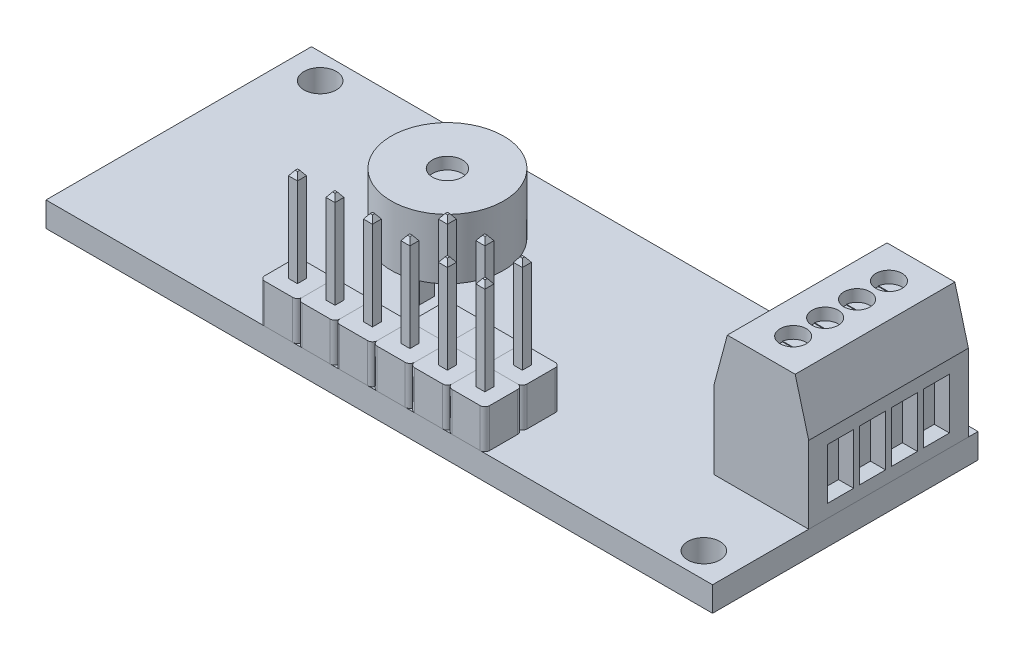
from build123d import *
from OCP.BRepFilletAPI import BRepFilletAPI_MakeChamfer

# Parameters (mm, degrees)
SKETCH1_W                 = 44.45
SKETCH1_H                 = 17.7038
BOSS_EXTRUDE1_DEPTH       = 0.8255
CUT_EXTRUDE1_DEPTH        = 24.979836522
CUT_EXTRUDE1_DEPTH_BACK   = 24.979836522
SKETCH2_R                 = 1.075
BOSS_EXTRUDE2_DEPTH       = 10.65
SKETCH4_W                 = 2.5
SKETCH4_H                 = 2.499995
BOSS_EXTRUDE3_DEPTH       = 2.599
SKETCH5_W                 = 0.6
SKETCH5_H                 = 0.6
BOSS_EXTRUDE4_DEPTH       = 6.25
CHAMFER1_SIZE             = 0.3175
CHAMFER1_SIZE2            = 0.222315893
FILLET1_R                 = 0.3175
LPATTERN2_COUNT           = 6
LPATTERN2_PITCH           = 2.5
LPATTERN3_COUNT           = 2
LPATTERN3_PITCH           = 2.5
SKETCH7_R                 = 3.75
BOSS_EXTRUDE5_DEPTH       = 6.45
SKETCH8_R                 = 3.75
SKETCH8_W                 = 1
SKETCH8_H                 = 1
CUT_EXTRUDE2_DEPTH        = 2.44
SKETCH9_R                 = 1
CUT_EXTRUDE3_DEPTH        = 0.79375
SKETCH10_R                = 0.875
CUT_EXTRUDE4_DEPTH        = 0.79375
SKETCH11_W                = 1.73
SKETCH11_H                = 3.4
CUT_EXTRUDE5_DEPTH        = 0.79375
CUT_EXTRUDE5_DRAFT        = -15
LPATTERN4_COPY_1_SKETCH_W = 1.73
LPATTERN4_COPY_1_SKETCH_H = 3.4
LPATTERN4_COPY_1_DEPTH    = 0.79375
LPATTERN4_COPY_1_DRAFT    = -15
LPATTERN4_COPY_2_SKETCH_W = 1.73
LPATTERN4_COPY_2_SKETCH_H = 3.4
LPATTERN4_COPY_2_DEPTH    = 0.79375
LPATTERN4_COPY_2_DRAFT    = -15
LPATTERN4_COPY_3_SKETCH_W = 1.73
LPATTERN4_COPY_3_SKETCH_H = 3.4
LPATTERN4_COPY_3_DEPTH    = 0.79375
LPATTERN4_COPY_3_DRAFT    = -15
CUT_EXTRUDE6_DEPTH        = 0.049609375
LPATTERN5_COUNT           = 4
LPATTERN5_PITCH           = 2.13


with BuildPart() as part:
    # Sketch1 → Boss-Extrude1 (new, symmetric)
    with BuildSketch(Plane(origin=(0, 0, 0), x_dir=(1, 0, 0), z_dir=(0, 1, 0))):
        Rectangle(SKETCH1_W, SKETCH1_H)
    extrude(amount=BOSS_EXTRUDE1_DEPTH, both=True)

    # Sketch2 → Cut-Extrude1 (cut, two sides: drawn at the far end of the back side and taken through both)
    with BuildSketch(Plane(origin=(0, 0.8255, 0), x_dir=(1, 0, 0), z_dir=(0, 1, 0)).offset(-CUT_EXTRUDE1_DEPTH_BACK)):
        with Locations((-19.97, 7.1769)):
            Circle(SKETCH2_R)
        with Locations((19.97, -7.1769)):
            Circle(SKETCH2_R)
    extrude(amount=CUT_EXTRUDE1_DEPTH + CUT_EXTRUDE1_DEPTH_BACK, mode=Mode.SUBTRACT)


with BuildPart() as body_2:
    # Sketch3 → Boss-Extrude2 (new body)
    with BuildSketch(Plane(origin=(0, 0, -8.21190001), x_dir=(-1, 0, 0), z_dir=(0, 0, -1))):
        Polygon((-22.225, 0.8255), (-22.225, 5.9555), (-21.322011222, 9.3255), (-16.797988778, 9.3255), (-15.895, 5.9555), (-15.895, 0.8255), align=None)
    extrude(amount=-BOSS_EXTRUDE2_DEPTH)

    # Sketch10 → Cut-Extrude4 (cut)
    with BuildSketch(Plane(origin=(0, 9.3255, 0), x_dir=(1, 0, 0), z_dir=(0, 1, 0))):
        with Locations((19.06, 6.08190001)):
            Circle(SKETCH10_R)
        with Locations((19.06, 3.95190001)):
            Circle(SKETCH10_R)
        with Locations((19.06, 1.82190001)):
            Circle(SKETCH10_R)
        with Locations((19.06, -0.30809999)):
            Circle(SKETCH10_R)
    extrude(amount=-CUT_EXTRUDE4_DEPTH, mode=Mode.SUBTRACT)


with BuildPart() as body_3:
    # Sketch4 → Boss-Extrude3 (new body)
    with BuildSketch(Plane(origin=(0, 0.8255, 0), x_dir=(1, 0, 0), z_dir=(0, 1, 0))):
        with Locations((5.795, -7.6019025)):
            Rectangle(SKETCH4_W, SKETCH4_H)
    extrude(amount=BOSS_EXTRUDE3_DEPTH)

    # Fillet1
    fillet1_edges = [body_3.edges().sort_by_distance(p)[0] for p in [
        (7.045, 2.125, 6.351905),
        (4.545, 2.125, 6.351905),
        (7.045, 2.125, 8.8519),
        (4.545, 2.125, 8.8519),
    ]]
    fillet(fillet1_edges, radius=FILLET1_R)


with BuildPart() as body_4:
    # Sketch5 → Boss-Extrude4 (new body)
    with BuildSketch(Plane(origin=(0, 3.4245, 0), x_dir=(1, 0, 0), z_dir=(0, 1, 0))):
        with Locations((5.795, -7.6019025)):
            Rectangle(SKETCH5_W, SKETCH5_H)
    extrude(amount=BOSS_EXTRUDE4_DEPTH)

    # Chamfer1: one chamfer whose edges measure the first distance from different faces: ONE call of the kernel's chamfer builder (chamfer() names one face for all edges)
    chamfer1_edges_1 = [body_4.edges().sort_by_distance(p)[0] for p in [
        (5.495, 9.6745, 7.6019025),
    ]]
    chamfer1_side_1 = [body_4.faces().sort_by_distance(p)[0] for p in [
        (5.495, 6.5495, 7.6019025),
    ]]
    chamfer1_edges_2 = [body_4.edges().sort_by_distance(p)[0] for p in [
        (5.795, 9.6745, 7.3019025),
    ]]
    chamfer1_side_2 = [body_4.faces().sort_by_distance(p)[0] for p in [
        (5.795, 6.5495, 7.3019025),
    ]]
    chamfer1_edges_3 = [body_4.edges().sort_by_distance(p)[0] for p in [
        (6.095, 9.6745, 7.6019025),
    ]]
    chamfer1_side_3 = [body_4.faces().sort_by_distance(p)[0] for p in [
        (6.095, 6.5495, 7.6019025),
    ]]
    chamfer1_edges_4 = [body_4.edges().sort_by_distance(p)[0] for p in [
        (5.795, 9.6745, 7.9019025),
    ]]
    chamfer1_side_4 = [body_4.faces().sort_by_distance(p)[0] for p in [
        (5.795, 6.5495, 7.9019025),
    ]]
    chamfer1 = BRepFilletAPI_MakeChamfer(body_4.part.solid().wrapped)
    for e in chamfer1_edges_1:
        chamfer1.Add(CHAMFER1_SIZE, CHAMFER1_SIZE2, e.wrapped, chamfer1_side_1[0].wrapped)  # the first distance lies on this face
    for e in chamfer1_edges_2:
        chamfer1.Add(CHAMFER1_SIZE, CHAMFER1_SIZE2, e.wrapped, chamfer1_side_2[0].wrapped)  # the first distance lies on this face
    for e in chamfer1_edges_3:
        chamfer1.Add(CHAMFER1_SIZE, CHAMFER1_SIZE2, e.wrapped, chamfer1_side_3[0].wrapped)  # the first distance lies on this face
    for e in chamfer1_edges_4:
        chamfer1.Add(CHAMFER1_SIZE, CHAMFER1_SIZE2, e.wrapped, chamfer1_side_4[0].wrapped)  # the first distance lies on this face
    add(Compound.cast(chamfer1.Shape()), mode=Mode.REPLACE)


with BuildPart() as lpattern2_1:
    # LPattern2: pattern copy
    add(body_4.part.moved(Location(Vector(-1, 0, 0) * (1 * LPATTERN2_PITCH))))


with BuildPart() as lpattern2_2:
    # LPattern2: pattern copy
    add(body_4.part.moved(Location(Vector(-1, 0, 0) * (2 * LPATTERN2_PITCH))))


with BuildPart() as lpattern2_3:
    # LPattern2: pattern copy
    add(body_4.part.moved(Location(Vector(-1, 0, 0) * (3 * LPATTERN2_PITCH))))


with BuildPart() as lpattern2_4:
    # LPattern2: pattern copy
    add(body_4.part.moved(Location(Vector(-1, 0, 0) * (4 * LPATTERN2_PITCH))))


with BuildPart() as lpattern2_5:
    # LPattern2: pattern copy
    add(body_4.part.moved(Location(Vector(-1, 0, 0) * (5 * LPATTERN2_PITCH))))


with BuildPart() as lpattern2_6:
    # LPattern2: pattern copy
    add(body_3.part.moved(Location(Vector(-1, 0, 0) * (1 * LPATTERN2_PITCH))))


with BuildPart() as lpattern2_7:
    # LPattern2: pattern copy
    add(body_3.part.moved(Location(Vector(-1, 0, 0) * (2 * LPATTERN2_PITCH))))


with BuildPart() as lpattern2_8:
    # LPattern2: pattern copy
    add(body_3.part.moved(Location(Vector(-1, 0, 0) * (3 * LPATTERN2_PITCH))))


with BuildPart() as lpattern2_9:
    # LPattern2: pattern copy
    add(body_3.part.moved(Location(Vector(-1, 0, 0) * (4 * LPATTERN2_PITCH))))


with BuildPart() as lpattern2_10:
    # LPattern2: pattern copy
    add(body_3.part.moved(Location(Vector(-1, 0, 0) * (5 * LPATTERN2_PITCH))))


with BuildPart() as lpattern3_1:
    # LPattern3: pattern copy
    add(body_4.part.moved(Location(Vector(0, 0, -1) * (1 * LPATTERN3_PITCH))))


with BuildPart() as lpattern3_2:
    # LPattern3: pattern copy
    add(lpattern2_1.part.moved(Location(Vector(0, 0, -1) * (1 * LPATTERN3_PITCH))))


with BuildPart() as lpattern3_3:
    # LPattern3: pattern copy
    add(lpattern2_2.part.moved(Location(Vector(0, 0, -1) * (1 * LPATTERN3_PITCH))))


with BuildPart() as lpattern3_4:
    # LPattern3: pattern copy
    add(lpattern2_7.part.moved(Location(Vector(0, 0, -1) * (1 * LPATTERN3_PITCH))))


with BuildPart() as lpattern3_5:
    # LPattern3: pattern copy
    add(lpattern2_6.part.moved(Location(Vector(0, 0, -1) * (1 * LPATTERN3_PITCH))))


with BuildPart() as lpattern3_6:
    # LPattern3: pattern copy
    add(body_3.part.moved(Location(Vector(0, 0, -1) * (1 * LPATTERN3_PITCH))))


with BuildPart() as body_21:
    # Sketch7 → Boss-Extrude5 (new body)
    with BuildSketch(Plane(origin=(0, 0.8255, 0), x_dir=(1, 0, 0), z_dir=(0, 1, 0))):
        with Locations((-4.205, -0.101905)):
            Circle(SKETCH7_R)
    extrude(amount=BOSS_EXTRUDE5_DEPTH)

    # Sketch8 → Cut-Extrude2 (cut)
    with BuildSketch(Plane(origin=(0, 0.8255, 0), x_dir=(1, 0, 0), z_dir=(0, 1, 0))):
        with Locations((-4.205, -0.101905)):
            Circle(SKETCH8_R)
        with Locations((-4.205, 1.773095)):
            Rectangle(SKETCH8_W, SKETCH8_H, mode=Mode.SUBTRACT)
        with Locations((-4.205, -1.976905)):
            Rectangle(SKETCH8_W, SKETCH8_H, mode=Mode.SUBTRACT)
    extrude(amount=CUT_EXTRUDE2_DEPTH, mode=Mode.SUBTRACT)

    # Sketch9 → Cut-Extrude3 (cut)
    with BuildSketch(Plane(origin=(0, 7.2755, 0), x_dir=(1, 0, 0), z_dir=(0, 1, 0))):
        with Locations((-4.205, -0.101905)):
            Circle(SKETCH9_R)
    extrude(amount=-CUT_EXTRUDE3_DEPTH, mode=Mode.SUBTRACT)


with BuildPart() as cut_extrude5_tool:
    # Sketch11 → Cut-Extrude5 (with draft: the straight prism first)
    with BuildSketch(Plane(origin=(22.225, 0, 0), x_dir=(0, 0, -1), z_dir=(1, 0, 0))):
        with Locations((-0.30809999, 3.3905)):
            Rectangle(SKETCH11_W, SKETCH11_H)
    extrude(amount=-CUT_EXTRUDE5_DEPTH)
    # Cut-Extrude5: the draft: its side faces are tilted about the plane it starts from
    cut_extrude5_sides = [cut_extrude5_tool.faces().sort_by_distance(p)[0] for p in [
        (21.828125, 5.0905, 0.30809999),
        (21.828125, 3.3905, 1.17309999),
        (21.828125, 1.6905, 0.30809999),
        (21.828125, 3.3905, -0.55690001),
    ]]
    draft(cut_extrude5_sides, Plane(origin=(22.225, 0, 0), x_dir=(0, 0, -1), z_dir=(1, 0, 0)), CUT_EXTRUDE5_DRAFT)


with BuildPart() as body_2_1:
    add(body_2.part)

    # Cut-Extrude5: cut by cut_extrude5_tool
    add(cut_extrude5_tool.part, mode=Mode.SUBTRACT)


with BuildPart() as lpattern4_copy_1_tool:
    # LPattern4 copy 1 sketch → LPattern4 copy 1 (with draft: the straight prism first)
    with BuildSketch(Plane(origin=(22.225, 0, -2.13), x_dir=(0, 0, -1), z_dir=(1, 0, 0))):
        with Locations((-0.30809999, 3.3905)):
            Rectangle(LPATTERN4_COPY_1_SKETCH_W, LPATTERN4_COPY_1_SKETCH_H)
    extrude(amount=-LPATTERN4_COPY_1_DEPTH)
    # LPattern4 copy 1: the draft: its side faces are tilted about the plane it starts from
    lpattern4_copy_1_sides = [lpattern4_copy_1_tool.faces().sort_by_distance(p)[0] for p in [
        (21.828125, 5.0905, -1.82190001),
        (21.828125, 3.3905, -0.95690001),
        (21.828125, 1.6905, -1.82190001),
        (21.828125, 3.3905, -2.68690001),
    ]]
    draft(lpattern4_copy_1_sides, Plane(origin=(22.225, 0, -2.13), x_dir=(0, 0, -1), z_dir=(1, 0, 0)), LPATTERN4_COPY_1_DRAFT)


with BuildPart() as body_2_2:
    add(body_2_1.part)

    # LPattern4 copy 1: cut by lpattern4_copy_1_tool
    add(lpattern4_copy_1_tool.part, mode=Mode.SUBTRACT)


with BuildPart() as lpattern4_copy_2_tool:
    # LPattern4 copy 2 sketch → LPattern4 copy 2 (with draft: the straight prism first)
    with BuildSketch(Plane(origin=(22.225, 0, -4.26), x_dir=(0, 0, -1), z_dir=(1, 0, 0))):
        with Locations((-0.30809999, 3.3905)):
            Rectangle(LPATTERN4_COPY_2_SKETCH_W, LPATTERN4_COPY_2_SKETCH_H)
    extrude(amount=-LPATTERN4_COPY_2_DEPTH)
    # LPattern4 copy 2: the draft: its side faces are tilted about the plane it starts from
    lpattern4_copy_2_sides = [lpattern4_copy_2_tool.faces().sort_by_distance(p)[0] for p in [
        (21.828125, 5.0905, -3.95190001),
        (21.828125, 3.3905, -3.08690001),
        (21.828125, 1.6905, -3.95190001),
        (21.828125, 3.3905, -4.81690001),
    ]]
    draft(lpattern4_copy_2_sides, Plane(origin=(22.225, 0, -4.26), x_dir=(0, 0, -1), z_dir=(1, 0, 0)), LPATTERN4_COPY_2_DRAFT)


with BuildPart() as body_2_3:
    add(body_2_2.part)

    # LPattern4 copy 2: cut by lpattern4_copy_2_tool
    add(lpattern4_copy_2_tool.part, mode=Mode.SUBTRACT)


with BuildPart() as lpattern4_copy_3_tool:
    # LPattern4 copy 3 sketch → LPattern4 copy 3 (with draft: the straight prism first)
    with BuildSketch(Plane(origin=(22.225, 0, -6.39), x_dir=(0, 0, -1), z_dir=(1, 0, 0))):
        with Locations((-0.30809999, 3.3905)):
            Rectangle(LPATTERN4_COPY_3_SKETCH_W, LPATTERN4_COPY_3_SKETCH_H)
    extrude(amount=-LPATTERN4_COPY_3_DEPTH)
    # LPattern4 copy 3: the draft: its side faces are tilted about the plane it starts from
    lpattern4_copy_3_sides = [lpattern4_copy_3_tool.faces().sort_by_distance(p)[0] for p in [
        (21.828125, 5.0905, -6.08190001),
        (21.828125, 3.3905, -5.21690001),
        (21.828125, 1.6905, -6.08190001),
        (21.828125, 3.3905, -6.94690001),
    ]]
    draft(lpattern4_copy_3_sides, Plane(origin=(22.225, 0, -6.39), x_dir=(0, 0, -1), z_dir=(1, 0, 0)), LPATTERN4_COPY_3_DRAFT)


with BuildPart() as body_2_4:
    add(body_2_3.part)

    # LPattern4 copy 3: cut by lpattern4_copy_3_tool
    add(lpattern4_copy_3_tool.part, mode=Mode.SUBTRACT)

    # Sketch12 → Cut-Extrude6 (cut)
    with BuildSketch(Plane(origin=(0, 8.53175, 0), x_dir=(1, 0, 0), z_dir=(0, 1, 0))):
        with BuildLine():
            Line((18.19952139, -0.46684999), (19.92047861, -0.46684999))
            ThreePointArc((19.92047861, -0.46684999), (19.935, -0.30809999), (19.92047861, -0.14934999))
            Line((19.92047861, -0.14934999), (18.19952139, -0.14934999))
            ThreePointArc((18.19952139, -0.14934999), (18.185, -0.30809999), (18.19952139, -0.46684999))
        make_face()
    cut_extrude6 = extrude(amount=-CUT_EXTRUDE6_DEPTH, mode=Mode.SUBTRACT)

    # LPattern5: Cut-Extrude6 ×4
    with Locations(*[(0, 0, -i * LPATTERN5_PITCH) for i in range(1, LPATTERN5_COUNT)]):
        add(cut_extrude6, mode=Mode.SUBTRACT)


solid = Compound([part.part, body_3.part, body_4.part, lpattern2_1.part, lpattern2_2.part, lpattern2_3.part, lpattern2_4.part, lpattern2_5.part, lpattern2_6.part, lpattern2_7.part, lpattern2_8.part, lpattern2_9.part, lpattern2_10.part, lpattern3_1.part, lpattern3_2.part, lpattern3_3.part, lpattern3_4.part, lpattern3_5.part, lpattern3_6.part, body_21.part, body_2_4.part])
